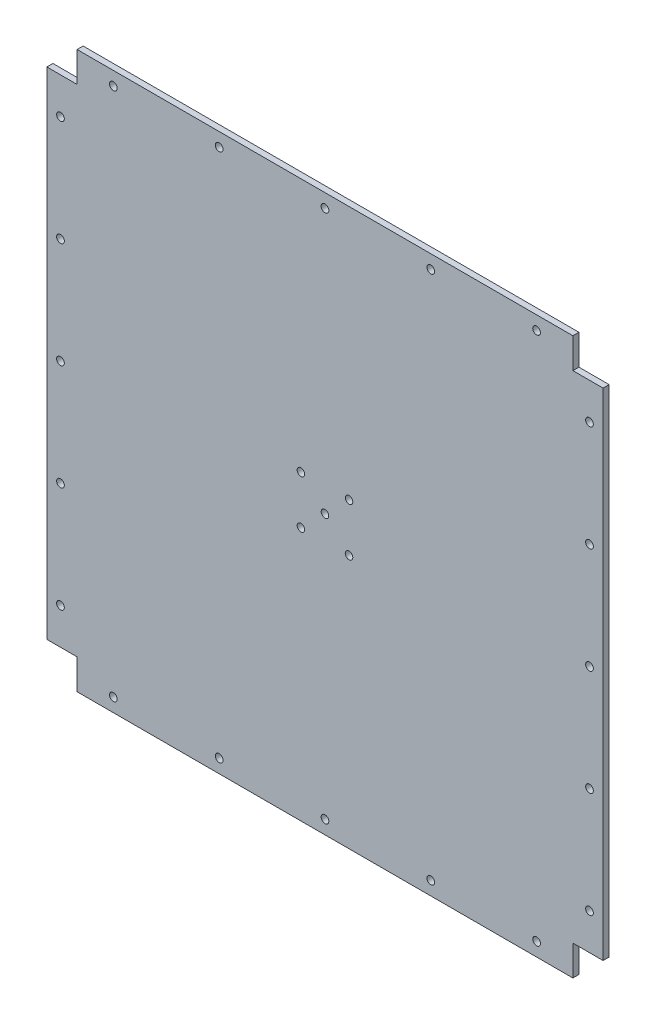
from build123d import *

# Parameters (mm, degrees)
SKETCH_1_W          = 368
SKETCH_1_H          = 368
EXTRUDE_1_DEPTH     = 4
SKETCH_3_R          = 2.55
CUT_EXTRUDE_2_DEPTH = 261.246037434
SKETCH_4_W          = 20
SKETCH_4_H          = 20
CUT_EXTRUDE_3_DEPTH = 261.246037434
SKETCH_5_R          = 2.5
CUT_EXTRUDE_6_DEPTH = 10


with BuildPart() as part:
    # 草图1 → 凸台-拉伸1 (new body)
    with BuildSketch(Plane.XY):
        Rectangle(SKETCH_1_W, SKETCH_1_H)
    extrude(amount=EXTRUDE_1_DEPTH)

    # 草图3 → 切除-拉伸2 (cut, through all)
    with BuildSketch(Plane.XY.offset(4)):
        with Locations((0, -175)):
            Circle(SKETCH_3_R)
        with Locations((70, -175)):
            Circle(SKETCH_3_R)
        with Locations((140, -175)):
            Circle(SKETCH_3_R)
        with Locations((-70, -175)):
            Circle(SKETCH_3_R)
        with Locations((-140, -175)):
            Circle(SKETCH_3_R)
        with Locations((-175, 140)):
            Circle(SKETCH_3_R)
        with Locations((-175, 70)):
            Circle(SKETCH_3_R)
        with Locations((-175, -70)):
            Circle(SKETCH_3_R)
        with Locations((-175, -140)):
            Circle(SKETCH_3_R)
        with Locations((-175, 0)):
            Circle(SKETCH_3_R)
        with Locations((140, 175)):
            Circle(SKETCH_3_R)
        with Locations((70, 175)):
            Circle(SKETCH_3_R)
        with Locations((-70, 175)):
            Circle(SKETCH_3_R)
        with Locations((-140, 175)):
            Circle(SKETCH_3_R)
        with Locations((0, 175)):
            Circle(SKETCH_3_R)
        with Locations((175, -140)):
            Circle(SKETCH_3_R)
        with Locations((175, -70)):
            Circle(SKETCH_3_R)
        with Locations((175, 70)):
            Circle(SKETCH_3_R)
        with Locations((175, 140)):
            Circle(SKETCH_3_R)
        with Locations((175, 0)):
            Circle(SKETCH_3_R)
    extrude(amount=-CUT_EXTRUDE_2_DEPTH, mode=Mode.SUBTRACT)

    # 草图4 → 切除-拉伸3 (cut, through all)
    with BuildSketch(Plane.XY.offset(4)):
        with Locations((-174, 174)):
            Rectangle(SKETCH_4_W, SKETCH_4_H)
        with Locations((-174, -174)):
            Rectangle(SKETCH_4_W, SKETCH_4_H)
        with Locations((174, 174)):
            Rectangle(SKETCH_4_W, SKETCH_4_H)
        with Locations((174, -174)):
            Rectangle(SKETCH_4_W, SKETCH_4_H)
    extrude(amount=-CUT_EXTRUDE_3_DEPTH, mode=Mode.SUBTRACT)

    # 草图5 → 切除-拉伸6 (cut)
    with BuildSketch(Plane.XY.offset(4)):
        Circle(SKETCH_5_R)
        with Locations((-15.909902577, 15.909902577)):
            Circle(SKETCH_5_R)
        with Locations((15.909902577, 15.909902577)):
            Circle(SKETCH_5_R)
        with Locations((15.909902577, -15.909902577)):
            Circle(SKETCH_5_R)
        with Locations((-15.909902577, -15.909902577)):
            Circle(SKETCH_5_R)
    extrude(amount=-CUT_EXTRUDE_6_DEPTH, mode=Mode.SUBTRACT)


solid = part.part
